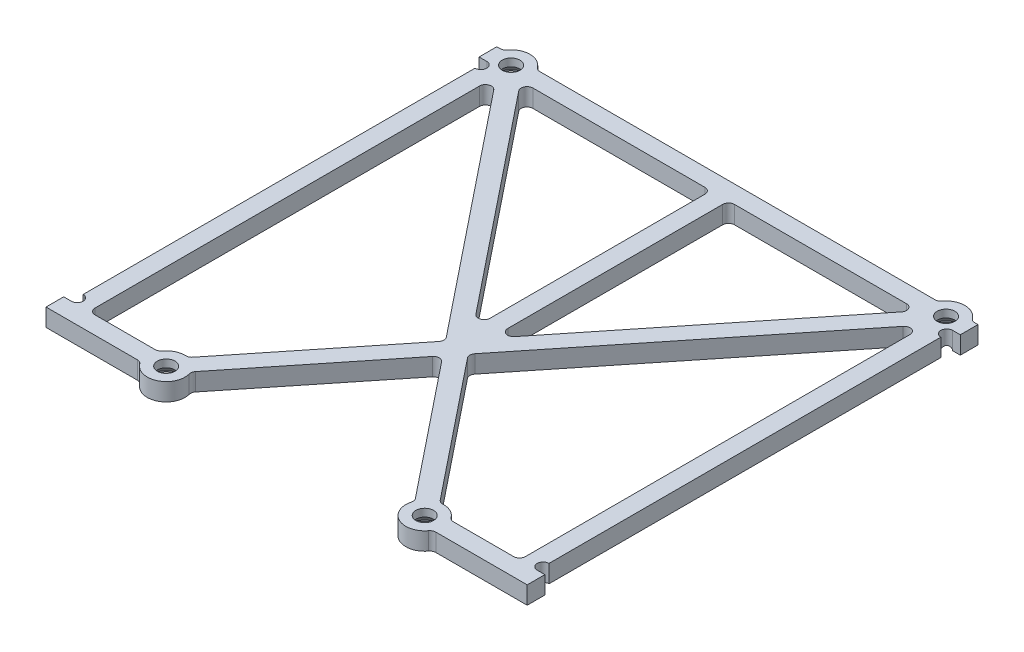
from build123d import *

# Parameters (mm, degrees)
SKETCH1_R                  = 1.5
SHAPE_DEPTH                = 3
MILL_FILLETS_R             = 1
M3_COUNTERSUNKS_AT_2_COUNT = 2
M3_COUNTERSUNKS_AT_2_PITCH = 43.84
M3_COUNTERSUNKS_AT_3_COUNT = 2
M3_COUNTERSUNKS_AT_3_PITCH = 94.086888034
M3_COUNTERSUNKS_AT_4_COUNT = 2
M3_COUNTERSUNKS_AT_4_PITCH = 74.958015582


with BuildPart() as part:
    # Sketch1 → Shape (new body)
    with BuildSketch(Plane(origin=(0, 0, 0), x_dir=(1, 0, 0), z_dir=(0, 1, 0))):
        with BuildLine():
            Line((-40.8, -38.225), (-24.746658805, -38.225))
            ThreePointArc((-24.746658805, -38.225), (-20.534274822, -39.609400411), (-18.982475511, -35.455767998))
            Line((-18.982475511, -35.455767998), (0, -11.743815171))
            Line((0, -11.743815171), (18.982475511, -35.455767998))
            ThreePointArc((18.982475511, -35.455767998), (20.534274822, -39.609400411), (24.746658805, -38.225))
            Line((24.746658805, -38.225), (40.8, -38.225))
            Line((40.8, -38.225), (40.8, -35.225))
            Line((40.8, -35.225), (39.5, -35.225))
            ThreePointArc((39.5, -35.225), (38.5, -34.225), (39.5, -33.225))
            Line((39.5, -33.225), (39.5, 33.225))
            ThreePointArc((39.5, 33.225), (38.5, 34.225), (39.5, 35.225))
            Line((39.5, 35.225), (40.8, 35.225))
            Line((40.8, 35.225), (40.8, 38.225))
            Line((40.8, 38.225), (39.706658805, 38.225))
            ThreePointArc((39.706658805, 38.225), (36.88, 39.925), (34.053341195, 38.225))
            Line((34.053341195, 38.225), (-34.053341195, 38.225))
            ThreePointArc((-34.053341195, 38.225), (-36.88, 39.925), (-39.706658805, 38.225))
            Line((-39.706658805, 38.225), (-40.8, 38.225))
            Line((-40.8, 38.225), (-40.8, 35.225))
            Line((-40.8, 35.225), (-39.5, 35.225))
            ThreePointArc((-39.5, 35.225), (-38.5, 34.225), (-39.5, 33.225))
            Line((-39.5, 33.225), (-39.5, -33.225))
            ThreePointArc((-39.5, -33.225), (-38.5, -34.225), (-39.5, -35.225))
            Line((-39.5, -35.225), (-40.8, -35.225))
            Line((-40.8, -35.225), (-40.8, -38.225))
        make_face()
        with BuildLine():
            Line((-24.746658805, -35.225), (-36.5, -35.225))
            Line((-36.5, -35.225), (-36.5, 31.00088061))
            ThreePointArc((-36.5, 31.00088061), (-35.831163581, 31.944453969), (-34.719338634, 31.625834875))
            Line((-34.719338634, 31.625834875), (-1.921447679, -9.343639456))
            Line((-1.921447679, -9.343639456), (-21.324459655, -33.580905266))
            ThreePointArc((-21.324459655, -33.580905266), (-23.305725178, -33.840599589), (-24.746658805, -35.225))
        make_face(mode=Mode.SUBTRACT)
        with Locations((-21.92, -36.725)):
            Circle(SKETCH1_R, mode=Mode.SUBTRACT)
        with Locations((-36.88, 36.725)):
            Circle(SKETCH1_R, mode=Mode.SUBTRACT)
        Polygon((-1.5, -5.069739251), (-33.757735438, 35.225), (-1.5, 35.225), align=None, mode=Mode.SUBTRACT)
        Polygon((1.5, 35.225), (33.757735438, 35.225), (1.5, -5.069739251), align=None, mode=Mode.SUBTRACT)
        with Locations((36.88, 36.725)):
            Circle(SKETCH1_R, mode=Mode.SUBTRACT)
        with BuildLine():
            Line((1.921447679, -9.343639456), (34.7193386, 31.625834832))
            ThreePointArc((34.7193386, 31.625834832), (35.831163555, 31.944453978), (36.5, 31.000880611))
            Line((36.5, 31.000880611), (36.5, -35.225))
            Line((36.5, -35.225), (24.746658805, -35.225))
            ThreePointArc((24.746658805, -35.225), (23.305725178, -33.840599589), (21.324459655, -33.580905266))
            Line((21.324459655, -33.580905266), (1.921447679, -9.343639456))
        make_face(mode=Mode.SUBTRACT)
        with Locations((21.92, -36.725)):
            Circle(SKETCH1_R, mode=Mode.SUBTRACT)
    extrude(amount=SHAPE_DEPTH)

    # Mill fillets
    mill_fillets_edges = [part.edges().sort_by_distance(p)[0] for p in [
        (39.706658805, 1.5, -38.225),
        (34.053341195, 1.5, -38.225),
        (-39.706658805, 1.5, -38.225),
        (-34.053341195, 1.5, -38.225),
        (-18.982475511, 1.5, 35.455767998),
        (-24.746658805, 1.5, 38.225),
        (24.746658805, 1.5, 38.225),
        (18.982475511, 1.5, 35.455767998),
        (24.746658805, 1.5, 35.225),
        (21.324459655, 1.5, 33.580905266),
        (1.921447679, 1.5, 9.343639456),
        (-21.324459655, 1.5, 33.580905266),
        (-24.746658805, 1.5, 35.225),
        (-1.921447679, 1.5, 9.343639456),
        (-36.5, 1.5, 35.225),
        (36.5, 1.5, 35.225),
        (-1.5, 1.5, 5.069739251),
        (1.5, 1.5, 5.069739251),
        (33.757735438, 1.5, -35.225),
        (1.5, 1.5, -35.225),
        (-1.5, 1.5, -35.225),
        (-33.757735438, 1.5, -35.225),
        (0, 1.5, 11.743815171),
    ]]
    fillet(mill_fillets_edges, radius=MILL_FILLETS_R)

    # Sketch3 → M3 countersunks (revolve, cut)
    with BuildSketch(Plane(origin=(-21.92, 0, 36.725), x_dir=(0, 0, -1), z_dir=(1, 0, 0))):
        Polygon((0, 0), (0, 3), (1.5, 3), (1.5, 1.7), (3, 0.2), (3, 0), align=None)
    m3_countersunks = revolve(axis=Axis((-21.92, -6.35, 36.725), (0, 1, 0)), mode=Mode.SUBTRACT)

    # M3 countersunks at 2: M3 countersunks ×2
    with Locations(*[(i * M3_COUNTERSUNKS_AT_2_PITCH, 0, 0) for i in range(1, M3_COUNTERSUNKS_AT_2_COUNT)]):
        add(m3_countersunks, mode=Mode.SUBTRACT)

    # M3 countersunks at 3: M3 countersunks ×2
    with Locations(*[Vector(0.6249542441928148, 0, -0.7806613815639838) * (i * M3_COUNTERSUNKS_AT_3_PITCH) for i in range(1, M3_COUNTERSUNKS_AT_3_COUNT)]):
        add(m3_countersunks, mode=Mode.SUBTRACT)

    # M3 countersunks at 4: M3 countersunks ×2
    with Locations(*[Vector(-0.19957838910000314, 0, -0.9798818635959377) * (i * M3_COUNTERSUNKS_AT_4_PITCH) for i in range(1, M3_COUNTERSUNKS_AT_4_COUNT)]):
        add(m3_countersunks, mode=Mode.SUBTRACT)


solid = part.part
